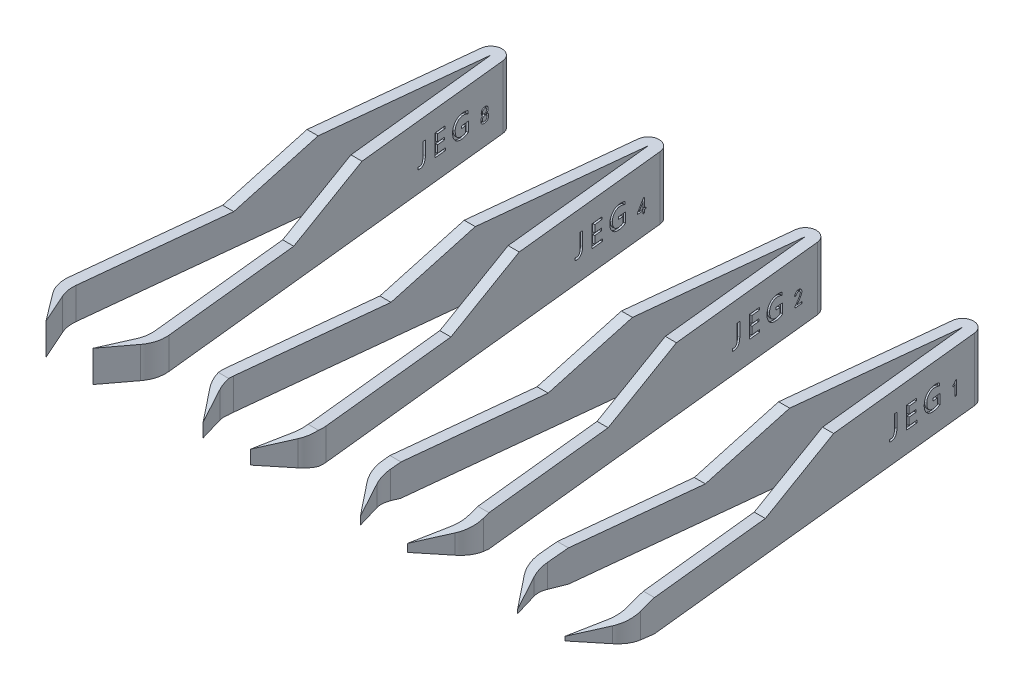
from build123d import *

# Parameters (mm, degrees)
EXTRUDE_510_DEPTH          = 16
CUT_EXTRUDE_729_DEPTH      = 110.141543163
CUT_EXTRUDE_729_DEPTH_BACK = 110.141543163
CUT_EXTRUDE_5_DEPTH        = 0.5
CUT_EXTRUDE_2_DEPTH        = 172.42262849
CUT_EXTRUDE_2_DEPTH_BACK   = 172.42262849
CUT_EXTRUDE_3_DEPTH        = 172.42262849
CUT_EXTRUDE_3_DEPTH_BACK   = 172.42262849
CUT_EXTRUDE_4_DEPTH        = 172.42262849
CUT_EXTRUDE_4_DEPTH_BACK   = 172.42262849
CUT_EXTRUDE_8_DEPTH        = 0.5
CUT_EXTRUDE_4_2_DEPTH      = 0.5
CUT_EXTRUDE_2_2_DEPTH      = 0.5
CUT_EXTRUDE_1_DEPTH        = 0.5


with BuildPart() as part:
    # Sketch 229 → Extrude 510 (new body)
    with BuildSketch(Plane(origin=(0, 0, 0), x_dir=(1, 0, 0), z_dir=(0, 1, 0))):
        with BuildLine():
            Line((-12.763846459, -94.652924797), (-2.784661307, 0.292679697))
            ThreePointArc((-2.784661307, 0.292679697), (0, 2.8), (2.784661307, 0.292679697))
            Line((2.784661307, 0.292679697), (12.763846459, -94.652924797))
            ThreePointArc((12.763846459, -94.652924797), (12.516714922, -97.627059512), (11.196755377, -100.303672688))
            Line((11.196755377, -100.303672688), (6, -107.2))
            Line((6, -107.2), (9.389355255, -99.587383458))
            ThreePointArc((9.389355255, -99.587383458), (9.982498318, -97.584966034), (10.037166756, -95.497262608))
            Line((10.037166756, -95.497262608), (0, 0))
            Line((0, 0), (-10.037166756, -95.497262608))
            ThreePointArc((-10.037166756, -95.497262608), (-9.982498318, -97.584966034), (-9.389355255, -99.587383458))
            Line((-9.389355255, -99.587383458), (-6, -107.2))
            Line((-6, -107.2), (-11.196755377, -100.303672688))
            ThreePointArc((-11.196755377, -100.303672688), (-12.516714922, -97.627059512), (-12.763846459, -94.652924797))
        make_face()
    extrude(amount=EXTRUDE_510_DEPTH)

    # Sketch 600 → Cut-Extrude 729 (cut, two sides: drawn at the far end of the back side and taken through both)
    with BuildSketch(Plane(origin=(0, 0, 0), x_dir=(0, 0, -1), z_dir=(1, 0, 0)).offset(-CUT_EXTRUDE_729_DEPTH_BACK)):
        Polygon((-107.2, 8), (-59.2, 8), (-39.783512161, 16), (-121.039092558, 27.463536836), align=None)
    extrude(amount=CUT_EXTRUDE_729_DEPTH + CUT_EXTRUDE_729_DEPTH_BACK, mode=Mode.SUBTRACT)

    # 草图7 → 切除-拉伸5 (cut)
    with BuildSketch(Plane(origin=(2.784661307, 0, -0.292679697), x_dir=(-0.10452846326765432, 0, -0.9945218953682733), z_dir=(0.9945218953682734, 0, -0.10452846326765433))):
        with BuildLine():
            Line((-24.324049204, 5.294945039), (-24.324049204, 5.933188179))
            add(Edge.make_bspline(
                [(-24.324049204, 5.933188179), (-24.248026892, 5.886509527), (-24.068354714, 5.816296052), (-23.876467428, 5.799250909), (-23.774887619, 5.799041838)],
                knots=[0, 0, 0, 0, 0.466417908, 1, 1, 1, 1], degree=3))
            add(Edge.make_bspline(
                [(-23.774887619, 5.799041838), (-23.707087537, 5.797595526), (-23.607633477, 5.809984144), (-23.482516426, 5.847913315), (-23.397595717, 5.887987253), (-23.320558748, 5.940706685), (-23.248165382, 6.002440193), (-23.18426918, 6.077863105), (-23.127881612, 6.164576759), (-23.077376317, 6.261804206), (-23.033293267, 6.37013167), (-22.997228147, 6.490309631), (-22.966643011, 6.621504573), (-22.944333564, 6.76413461), (-22.921218982, 6.976378368), (-22.91502871, 7.141789537), (-22.915512619, 7.255787264)],
                knots=[0, 0, 0, 0, 0.106608302, 0.156752619, 0.205505894, 0.253903597, 0.303461339, 0.354988549, 0.409035788, 0.466157673, 0.527388836, 0.593033596, 0.663670078, 0.73950742, 0.820357454, 1, 1, 1, 1], degree=3))
            Line((-22.915512619, 7.255787264), (-22.915512619, 10.762456472))
            Line((-22.915512619, 10.762456472), (-22.177707741, 10.762456472))
            Line((-22.177707741, 10.762456472), (-22.177707741, 7.273603575))
            add(Edge.make_bspline(
                [(-22.177707741, 7.273603575), (-22.177529837, 7.117196181), (-22.188423158, 6.888224893), (-22.234280711, 6.595184643), (-22.279731688, 6.395024368), (-22.341035177, 6.210001909), (-22.412666522, 6.037195445), (-22.500120395, 5.879819391), (-22.599579805, 5.736612591), (-22.710905762, 5.609621208), (-22.832019764, 5.498154685), (-22.96375544, 5.404968831), (-23.104196031, 5.326867103), (-23.255531912, 5.268918556), (-23.473278678, 5.209298081), (-23.645870636, 5.196061826), (-23.762311399, 5.195383301)],
                knots=[0, 0, 0, 0, 0.159071876, 0.23240712, 0.301324221, 0.367473493, 0.430334935, 0.491218005, 0.550134411, 0.607264001, 0.662568442, 0.717064202, 0.770945486, 0.825486358, 0.881397531, 1, 1, 1, 1], degree=3))
            add(Edge.make_bspline(
                [(-23.762311399, 5.195383301), (-23.866187891, 5.195007389), (-24.057854192, 5.209147201), (-24.244186316, 5.257929753), (-24.324049204, 5.294945039)],
                knots=[0, 0, 0, 0, 0.542364568, 1, 1, 1, 1], degree=3))
        make_face()
        Polygon((-16.476488229, 5.262456472), (-19.427707741, 5.262456472), (-19.427707741, 10.762456472), (-16.61063457, 10.762456472), (-16.61063457, 10.158797935), (-18.689902863, 10.158797935), (-18.689902863, 8.347822325), (-16.744780912, 8.347822325), (-16.744780912, 7.744163789), (-18.689902863, 7.744163789), (-18.689902863, 5.866115008), (-16.476488229, 5.866115008), align=None)
        with BuildLine():
            Line((-10.037463839, 10.544468667), (-10.037463839, 9.806663789))
            add(Edge.make_bspline(
                [(-10.037463839, 9.806663789), (-10.147211254, 9.877027121), (-10.321430305, 9.968784194), (-10.56661148, 10.065174667), (-10.759167126, 10.123513788), (-10.958964586, 10.170163337), (-11.240763154, 10.213339557), (-11.457487521, 10.226606322), (-11.604251186, 10.225871106)],
                knots=[0, 0, 0, 0, 0.237729296, 0.358233771, 0.480226218, 0.604546374, 0.732298464, 1, 1, 1, 1], degree=3))
            add(Edge.make_bspline(
                [(-11.604251186, 10.225871106), (-11.747552562, 10.226591824), (-11.959446821, 10.207948942), (-12.230732265, 10.142485844), (-12.421550583, 10.075688246), (-12.601815838, 9.987707823), (-12.772436188, 9.881211887), (-12.933793506, 9.756011372), (-13.082724575, 9.611337417), (-13.218628275, 9.452196583), (-13.336891382, 9.278892027), (-13.436486141, 9.093604168), (-13.519247405, 8.896269875), (-13.5813407, 8.685921442), (-13.642831645, 8.383337846), (-13.658940933, 8.14747092), (-13.659415058, 7.987304033)],
                knots=[0, 0, 0, 0, 0.125969474, 0.186009532, 0.244972384, 0.303350822, 0.361983194, 0.421513633, 0.482548577, 0.544210846, 0.605204821, 0.666631058, 0.728859788, 0.792989861, 0.859125726, 1, 1, 1, 1], degree=3))
            add(Edge.make_bspline(
                [(-13.659415058, 7.987304033), (-13.659646345, 7.823672381), (-13.644299192, 7.584524529), (-13.588935265, 7.278077417), (-13.531339828, 7.06856334), (-13.457122089, 6.872814798), (-13.365722358, 6.691352721), (-13.257178762, 6.524973884), (-13.13322344, 6.373409829), (-12.994847822, 6.238368954), (-12.844472799, 6.1200373), (-12.681510915, 6.020624413), (-12.506655003, 5.940452621), (-12.320999601, 5.875433704), (-12.051563475, 5.814733699), (-11.840569678, 5.800108239), (-11.697524814, 5.799041838)],
                knots=[0, 0, 0, 0, 0.147501684, 0.215382095, 0.280397875, 0.343092726, 0.403791293, 0.463185178, 0.521811921, 0.57993327, 0.637132791, 0.693948748, 0.751573178, 0.810231205, 0.870962438, 1, 1, 1, 1], degree=3))
            add(Edge.make_bspline(
                [(-11.697524814, 5.799041838), (-11.597802997, 5.799398193), (-11.45042899, 5.806620449), (-11.258811077, 5.832074147), (-11.123160728, 5.857837324), (-10.994072619, 5.892669602), (-10.831181461, 5.948217325), (-10.714996429, 6.001517153), (-10.641122375, 6.042182082)],
                knots=[0, 0, 0, 0, 0.273089439, 0.403369924, 0.529064051, 0.650883818, 0.769163094, 1, 1, 1, 1], degree=3))
            Line((-10.641122375, 6.042182082), (-10.641122375, 7.542944277))
            Line((-10.641122375, 7.542944277), (-11.848439448, 7.542944277))
            Line((-11.848439448, 7.542944277), (-11.848439448, 8.146602813))
            Line((-11.848439448, 8.146602813), (-9.903317497, 8.146602813))
            Line((-9.903317497, 8.146602813), (-9.903317497, 5.657559368))
            add(Edge.make_bspline(
                [(-9.903317497, 5.657559368), (-10.04009821, 5.58160624), (-10.25230794, 5.478799986), (-10.548293968, 5.373219142), (-10.777118441, 5.307566877), (-11.012518174, 5.257692955), (-11.338848948, 5.209856312), (-11.588133638, 5.195081235), (-11.756213839, 5.195383301)],
                knots=[0, 0, 0, 0, 0.243134103, 0.365368747, 0.487859787, 0.612727896, 0.738918392, 1, 1, 1, 1], degree=3))
            add(Edge.make_bspline(
                [(-11.756213839, 5.195383301), (-11.945451634, 5.194284793), (-12.223778322, 5.217702419), (-12.580766843, 5.29497795), (-12.828850519, 5.377119279), (-13.062064731, 5.483595536), (-13.282021212, 5.611725986), (-13.486020746, 5.764983986), (-13.674549596, 5.939669567), (-13.843942592, 6.134521085), (-13.992779007, 6.345979508), (-14.117803015, 6.574038694), (-14.220805339, 6.816956582), (-14.300772318, 7.075718256), (-14.377288113, 7.449706666), (-14.396718726, 7.741778241), (-14.397219936, 7.94014321)],
                knots=[0, 0, 0, 0, 0.132127422, 0.194359175, 0.254786118, 0.314307396, 0.373155964, 0.432263553, 0.492185725, 0.552381099, 0.612299793, 0.672483787, 0.73372138, 0.796322883, 0.861367418, 1, 1, 1, 1], degree=3))
            add(Edge.make_bspline(
                [(-14.397219936, 7.94014321), (-14.397201173, 8.142173136), (-14.374549986, 8.440822166), (-14.288924939, 8.82329589), (-14.202294778, 9.09172444), (-14.087899222, 9.345047269), (-13.950673506, 9.585814606), (-13.785805827, 9.810523467), (-13.598559966, 10.019543463), (-13.392284392, 10.209694555), (-13.169425916, 10.376120066), (-12.931852917, 10.516559441), (-12.68045441, 10.630802496), (-12.41512266, 10.720679769), (-12.035892653, 10.807173118), (-11.739548493, 10.829255283), (-11.539274052, 10.829529643)],
                knots=[0, 0, 0, 0, 0.13301234, 0.196153543, 0.257589465, 0.318307067, 0.378762934, 0.439648758, 0.501357676, 0.563189392, 0.623977903, 0.684069387, 0.744462707, 0.80538932, 0.86813288, 1, 1, 1, 1], degree=3))
            add(Edge.make_bspline(
                [(-11.539274052, 10.829529643), (-11.396896181, 10.83022337), (-11.187443583, 10.821050132), (-10.914624328, 10.791906588), (-10.722686167, 10.760125132), (-10.53878014, 10.720869911), (-10.308452254, 10.655677699), (-10.142609659, 10.593866412), (-10.037463839, 10.544468667)],
                knots=[0, 0, 0, 0, 0.27720918, 0.407935939, 0.534098837, 0.65593174, 0.773961276, 1, 1, 1, 1], degree=3))
        make_face()
    extrude(amount=-CUT_EXTRUDE_5_DEPTH, mode=Mode.SUBTRACT)


with BuildPart() as body_2:
    # Move Body 4: read off the stored shape, not the designer's step
    # Move Body 4: copy of part
    add(part.part.moved(Location((120, 0, 0))))

    # 4号 → Cut-Extrude 4 (cut, two sides: drawn at the far end of the back side and taken through both)
    with BuildSketch(Plane(origin=(0, 0, 0), x_dir=(0, 0, -1), z_dir=(1, 0, 0)).offset(-CUT_EXTRUDE_4_DEPTH_BACK)):
        Polygon((-107.2, 4.5), (-90.733794617, 8), (-90.829401652, 16), (-113.680324052, 26.530601745), align=None)
        Polygon((-107.2, 3.5), (-90.733794617, 0), (-114.904354173, -6.21298796), align=None)
    extrude(amount=CUT_EXTRUDE_4_DEPTH + CUT_EXTRUDE_4_DEPTH_BACK, mode=Mode.SUBTRACT)

    # 草图13 → 1标注 (cut)
    with BuildSketch(Plane(origin=(121.473517351, 0, -12.767381146), x_dir=(-0.10452846326765432, 0, -0.9945218953682733), z_dir=(0.9945218953682734, 0, -0.10452846326765433))):
        with BuildLine():
            add(Edge.make_bspline(
                [(-18.098239685, 7.893390772), (-18.144838358, 7.848683705), (-18.240869249, 7.756551051), (-18.402394809, 7.628533772), (-18.580427178, 7.501563682), (-18.708014224, 7.422424635), (-18.773678281, 7.381694866)],
                knots=[0, 0, 0, 0, 0.911926792, 1.879305458, 2.908561558, 4, 4, 4, 4], degree=3))
            Line((-18.773678281, 7.381694866), (-18.773678281, 7.770583755))
            add(Edge.make_bspline(
                [(-18.773678281, 7.770583755), (-18.731652034, 7.799698112), (-18.648187089, 7.857519794), (-18.529745779, 7.951566299), (-18.415236349, 8.047325785), (-18.308121529, 8.148709535), (-18.204995054, 8.252261358), (-18.10927276, 8.360883181), (-18.018113591, 8.472489792), (-17.962392889, 8.5503283), (-17.934496995, 8.589297205)],
                knots=[0, 0, 0, 0, 1.040526584, 2.066506081, 3.077559129, 4.07840537, 5.067830316, 6.05167646, 7.024595449, 8, 8, 8, 8], degree=3))
            Line((-17.934496995, 8.589297205), (-17.68888296, 8.589297205))
            Line((-17.68888296, 8.589297205), (-17.68888296, 5.068829369))
            Line((-17.68888296, 5.068829369), (-18.098239685, 5.068829369))
            Line((-18.098239685, 5.068829369), (-18.098239685, 7.893390772))
        make_face()
    extrude(amount=-CUT_EXTRUDE_1_DEPTH, mode=Mode.SUBTRACT)


with BuildPart() as body_3:
    # Move Body 4 2: copy of part
    add(part.part.moved(Location((80, 0, 0))))

    # 3号 → 切除-拉伸3 (cut, two sides: drawn at the far end of the back side and taken through both)
    with BuildSketch(Plane(origin=(0, 0, 0), x_dir=(0, 0, -1), z_dir=(1, 0, 0)).offset(-CUT_EXTRUDE_3_DEPTH_BACK)):
        Polygon((-111.304402429, -4.033826528), (-107.2, 3), (-93.086109672, 0), align=None)
        Polygon((-93.086109672, 8), (-109.658032158, 10.802090594), (-107.2, 5), align=None)
    extrude(amount=CUT_EXTRUDE_3_DEPTH + CUT_EXTRUDE_3_DEPTH_BACK, mode=Mode.SUBTRACT)

    # 草图11 → Cut-Extrude 2 2 (cut)
    with BuildSketch(Plane(origin=(81.910565336, 0, -8.60914733), x_dir=(-0.10452846326765432, 0, -0.9945218953682733), z_dir=(0.9945218953682734, 0, -0.10452846326765433))):
        with BuildLine():
            add(Edge.make_bspline(
                [(-14.816495196, 5.056353563), (-14.814019243, 5.081706472), (-14.809098162, 5.132096662), (-14.791818201, 5.206227207), (-14.767504026, 5.278604899), (-14.735515964, 5.349197288), (-14.69601891, 5.418032985), (-14.647436555, 5.48365459), (-14.593185785, 5.548954358), (-14.528306573, 5.610673946), (-14.458352371, 5.676343674), (-14.385894858, 5.751510851), (-14.307413315, 5.833575194), (-14.226087726, 5.926033992), (-14.138484325, 6.025562368), (-14.047972819, 6.135101033), (-13.952391425, 6.252554941), (-13.854422435, 6.375740295), (-13.758416197, 6.499464864), (-13.669943796, 6.61937242), (-13.589485294, 6.731332933), (-13.517690004, 6.835741673), (-13.456470994, 6.933801451), (-13.40330818, 7.023990565), (-13.357946196, 7.106145927), (-13.312679339, 7.204266773), (-13.269956451, 7.317425912), (-13.236457114, 7.445978002), (-13.221234512, 7.564951219), (-13.227218874, 7.674279637), (-13.250718929, 7.774049545), (-13.291777568, 7.864564177), (-13.34939717, 7.946145043), (-13.423063883, 8.015742296), (-13.507035012, 8.073041538), (-13.600480112, 8.111540576), (-13.700465486, 8.130997052), (-13.805068662, 8.129236756), (-13.910504794, 8.11049151), (-14.01554171, 8.077908925), (-14.116798346, 8.027458803), (-14.215997256, 7.964520388), (-14.307905968, 7.883436686), (-14.388688677, 7.783585437), (-14.457409153, 7.665475302), (-14.491693969, 7.578220958), (-14.509477652, 7.53296175)],
                knots=[0, 0, 0, 0, 0.683264685, 1.358023177, 2.0380809, 2.730345762, 3.435487858, 4.164189287, 4.919895072, 5.711413948, 6.565494804, 7.49616148, 8.513531843, 9.613812574, 10.80147361, 12.073102873, 13.428218159, 14.866997124, 16.298560904, 17.632315587, 18.867297526, 20.000038836, 21.033387935, 21.969994494, 22.810824564, 23.551397478, 24.869445784, 26.052467085, 27.111050094, 28.075902372, 28.975949733, 29.847314516, 30.728213316, 31.639844513, 32.554273251, 33.442456201, 34.333871785, 35.270085163, 36.233696473, 37.201335111, 38.211692251, 39.261697588, 40.347896805, 41.485826765, 42.695887429, 44, 44, 44, 44], degree=3))
            Line((-14.509477652, 7.53296175), (-14.898366541, 7.594365259))
            add(Edge.make_bspline(
                [(-14.898366541, 7.594365259), (-14.884636391, 7.632433437), (-14.857923483, 7.706497575), (-14.811924791, 7.81196132), (-14.764407059, 7.910134357), (-14.714066018, 8.000366204), (-14.659809545, 8.082012788), (-14.60295361, 8.155867874), (-14.543244876, 8.221921567), (-14.48045379, 8.280096606), (-14.414795984, 8.331380729), (-14.345820566, 8.375855972), (-14.27438639, 8.414706287), (-14.200212458, 8.44767798), (-14.1231386, 8.474249925), (-14.042822121, 8.493573391), (-13.960084508, 8.508564533), (-13.903587481, 8.513113885), (-13.874974728, 8.51541789)],
                knots=[0, 0, 0, 0, 1.318688324, 2.565594597, 3.747971738, 4.872722892, 5.930337296, 6.940181326, 7.908044283, 8.828858542, 9.726735078, 10.619953387, 11.500744836, 12.374616489, 13.262770363, 14.15366946, 15.064931369, 16, 16, 16, 16], degree=3))
            add(Edge.make_bspline(
                [(-13.874974728, 8.51541789), (-13.841643419, 8.518091184), (-13.776820473, 8.523290222), (-13.681809889, 8.524269122), (-13.592145962, 8.518067874), (-13.50624221, 8.506290581), (-13.422318711, 8.485471056), (-13.338213549, 8.454750296), (-13.253131339, 8.41322778), (-13.167210454, 8.362299928), (-13.082987847, 8.299956929), (-13.006737391, 8.221563989), (-12.939449515, 8.128638875), (-12.879329499, 8.023517993), (-12.830802917, 7.905330385), (-12.801619039, 7.773687231), (-12.790917333, 7.630885695), (-12.796797621, 7.504925191), (-12.811121631, 7.398338842), (-12.831191136, 7.313153077), (-12.860114681, 7.224474518), (-12.894168965, 7.130929668), (-12.939389347, 7.03473687), (-12.990288146, 6.933831269), (-13.051155066, 6.830042271), (-13.106391351, 6.74037373), (-13.156436029, 6.665714475), (-13.198352818, 6.604791993), (-13.244144567, 6.539760068), (-13.295542004, 6.471652692), (-13.349824199, 6.398908253), (-13.408214167, 6.322155141), (-13.471220145, 6.242058773), (-13.538113326, 6.157603987), (-13.609195753, 6.069016005), (-13.684788244, 5.976808205), (-13.764869919, 5.881187946), (-13.848194598, 5.780859486), (-13.935776903, 5.676663747), (-14.027683906, 5.568698907), (-14.124219139, 5.457451468), (-14.189595634, 5.381584279), (-14.222927945, 5.342903271)],
                knots=[0, 0, 0, 0, 0.924262298, 1.797511285, 2.623724224, 3.407158757, 4.191620419, 5.009283641, 5.877881841, 6.805175164, 7.767818098, 8.765683208, 9.814991193, 10.931884262, 12.107176208, 13.332417047, 14.642951659, 16.055476784, 16.810263112, 17.613474593, 18.470705512, 19.388078144, 20.363412498, 21.406914204, 22.511682051, 23.688322701, 24.318011351, 24.996206783, 25.732766533, 26.516574724, 27.354866926, 28.242087009, 29.182574856, 30.172115786, 31.220563025, 32.322544456, 33.468316952, 34.668650042, 35.928027342, 37.231299145, 38.588373428, 40, 40, 40, 40], degree=3))
            Line((-14.222927945, 5.342903271), (-12.749243734, 5.342903271))
            Line((-12.749243734, 5.342903271), (-12.749243734, 4.974482218))
            Line((-12.749243734, 4.974482218), (-14.816495196, 4.974482218))
            Line((-14.816495196, 4.974482218), (-14.816495196, 5.056353563))
        make_face()
    extrude(amount=-CUT_EXTRUDE_2_2_DEPTH, mode=Mode.SUBTRACT)


with BuildPart() as body_4:
    # Move Body 4 3: copy of part
    add(part.part.moved(Location((40, 0, 0))))

    # 2号 → Cut-Extrude 2 (cut, two sides: drawn at the far end of the back side and taken through both)
    with BuildSketch(Plane(origin=(0, 0, 0), x_dir=(0, 0, -1), z_dir=(1, 0, 0)).offset(-CUT_EXTRUDE_2_DEPTH_BACK)):
        Polygon((-107.2, 5.75), (-96.614582254, 8), (-110.199807714, 11.269828457), align=None)
        Polygon((-107.2, 2.25), (-96.614582254, 0), (-109.947860282, -4.450274704), align=None)
    extrude(amount=CUT_EXTRUDE_2_DEPTH + CUT_EXTRUDE_2_DEPTH_BACK, mode=Mode.SUBTRACT)

    # 草图12 → Cut-Extrude 4 2 (cut)
    with BuildSketch(Plane(origin=(42.347613322, 0, -4.450913514), x_dir=(-0.10452846326765432, 0, -0.9945218953682733), z_dir=(0.9945218953682734, 0, -0.10452846326765433))):
        Polygon((-9.053368335, 5.672598547), (-10.629391727, 5.672598547), (-10.629391727, 6.020551763), (-8.97149699, 8.415288605), (-8.664479447, 8.415288605), (-8.664479447, 6.020551763), (-8.173251376, 6.020551763), (-8.173251376, 5.672598547), (-8.664479447, 5.672598547), (-8.664479447, 4.894820769), (-9.053368335, 4.894820769), align=None)
        Polygon((-9.053368335, 6.020551763), (-9.053368335, 7.637510827), (-10.199567166, 6.020551763), align=None, mode=Mode.SUBTRACT)
    extrude(amount=-CUT_EXTRUDE_4_2_DEPTH, mode=Mode.SUBTRACT)


with BuildPart() as part_1:
    add(part.part)

    # 草图10 → 8标注 (cut)
    with BuildSketch(Plane(origin=(2.784661307, 0, -0.292679697), x_dir=(-0.10452846326765432, 0, -0.9945218953682733), z_dir=(0.9945218953682734, 0, -0.10452846326765433))):
        with BuildLine():
            add(Edge.make_bspline(
                [(-6.322846129, 6.201427452), (-6.321451799, 6.242228171), (-6.318648745, 6.324250792), (-6.293713114, 6.445796364), (-6.255703282, 6.566256902), (-6.211100235, 6.663993758), (-6.167593728, 6.740353686), (-6.12862668, 6.794877638), (-6.085030682, 6.846818659), (-6.036782993, 6.896236339), (-5.982209634, 6.941723025), (-5.923237642, 6.984796635), (-5.859330854, 7.025410977), (-5.813866623, 7.049031446), (-5.790682387, 7.061076575)],
                knots=[0, 0, 0, 0, 1.374126598, 2.76243824, 4.166032791, 5.626085304, 6.374165685, 7.125778304, 7.881627021, 8.658683375, 9.450540369, 10.273494042, 11.119577685, 12, 12, 12, 12], degree=3))
            add(Edge.make_bspline(
                [(-5.790682387, 7.061076575), (-5.828678509, 7.084716644), (-5.900820187, 7.129601074), (-5.994333472, 7.206922253), (-6.067440538, 7.288819164), (-6.120472178, 7.376099904), (-6.156478214, 7.468794136), (-6.183661792, 7.566141937), (-6.202670649, 7.669649459), (-6.212151706, 7.776974378), (-6.21263619, 7.883851361), (-6.202169669, 7.98551399), (-6.181907825, 8.079740452), (-6.151136852, 8.166775113), (-6.110056627, 8.24840188), (-6.059396176, 8.326031476), (-6.001938376, 8.402756233), (-5.934983949, 8.474183156), (-5.862737838, 8.539950193), (-5.785080472, 8.595125568), (-5.703175054, 8.638132371), (-5.61690405, 8.669060533), (-5.527365708, 8.691436587), (-5.434074281, 8.707280723), (-5.337336189, 8.717286542), (-5.238052859, 8.719718675), (-5.139620812, 8.717721615), (-5.044666353, 8.710281278), (-4.955032347, 8.6973957), (-4.868791445, 8.679376183), (-4.783920245, 8.652165093), (-4.697308554, 8.615026784), (-4.609931979, 8.563510876), (-4.519383093, 8.504905061), (-4.433454254, 8.432375232), (-4.359867584, 8.343376033), (-4.298812807, 8.240740375), (-4.26004325, 8.144904692), (-4.237366798, 8.062286008), (-4.224003748, 7.99701987), (-4.217620876, 7.928967262), (-4.215765438, 7.858491185), (-4.221104514, 7.785358835), (-4.229620962, 7.709520513), (-4.24538236, 7.631409994), (-4.265335025, 7.5516605), (-4.2915487, 7.472065288), (-4.329310045, 7.396641738), (-4.376115096, 7.325621457), (-4.431421673, 7.258624424), (-4.496983978, 7.196841445), (-4.571211554, 7.139236842), (-4.655363314, 7.086812198), (-4.7157408, 7.056310707), (-4.746822738, 7.040608739)],
                knots=[0, 0, 0, 0, 1.410033332, 2.677172402, 3.812064432, 4.856127883, 5.878591605, 6.938109193, 8.03995885, 9.192064022, 10.3315345, 11.405101817, 12.408541443, 13.363710648, 14.308049618, 15.282826904, 16.283668828, 17.326789228, 18.365059226, 19.359919842, 20.322241493, 21.272612498, 22.242786748, 23.229219042, 24.254411489, 25.306713209, 26.358803724, 27.358026599, 28.307996659, 29.212919167, 30.132734509, 31.114165642, 32.177631088, 33.326839266, 34.513504529, 35.70718515, 36.950754538, 38.266204093, 38.952498493, 39.651034787, 40.363832527, 41.105058096, 41.871509902, 42.674059092, 43.510125888, 44.381738271, 45.266222349, 46.146424753, 47.03266586, 47.943741995, 48.879333301, 49.867534116, 50.90222043, 52, 52, 52, 52], degree=3))
            add(Edge.make_bspline(
                [(-4.746822738, 7.040608739), (-4.718631939, 7.031924893), (-4.663883468, 7.015060268), (-4.586519674, 6.983704304), (-4.515322437, 6.949360081), (-4.450076538, 6.912197158), (-4.392190541, 6.869577607), (-4.339403326, 6.825316841), (-4.29349174, 6.776527862), (-4.242248044, 6.706127203), (-4.188973378, 6.610665717), (-4.143916586, 6.484390886), (-4.117956343, 6.346592364), (-4.109786674, 6.20221032), (-4.116447582, 6.060503379), (-4.131517158, 5.92910672), (-4.161082172, 5.813005133), (-4.20176736, 5.711722255), (-4.25044942, 5.623164158), (-4.299815302, 5.542094564), (-4.352425359, 5.468776907), (-4.408183735, 5.402365292), (-4.470365924, 5.342507608), (-4.542822945, 5.290721826), (-4.625375163, 5.245334846), (-4.718063357, 5.205707028), (-4.822718193, 5.174321271), (-4.939704314, 5.153288244), (-5.069419039, 5.139603883), (-5.207982973, 5.135765101), (-5.347790905, 5.139721684), (-5.481019149, 5.15341681), (-5.60441509, 5.174841682), (-5.71790351, 5.20593697), (-5.822126279, 5.245595035), (-5.915702057, 5.296975778), (-6.002566572, 5.353709171), (-6.078232979, 5.421958357), (-6.144401563, 5.496816514), (-6.199701548, 5.578396716), (-6.242375866, 5.666936534), (-6.274416283, 5.761734584), (-6.295274264, 5.863268613), (-6.31123843, 5.970315845), (-6.321431706, 6.083731527), (-6.322366064, 6.16148066), (-6.322846129, 6.201427452)],
                knots=[0, 0, 0, 0, 0.834664037, 1.620974963, 2.359958192, 3.071500661, 3.742523023, 4.391885647, 5.019370884, 5.633088925, 6.853041206, 8.099687998, 9.411290177, 10.808708308, 12.183221387, 13.42351142, 14.545940998, 15.563362997, 16.504155904, 17.403380615, 18.249005911, 19.055869055, 19.855247075, 20.685085447, 21.568786071, 22.517377533, 23.533390568, 24.654269325, 25.877028168, 27.222423441, 28.574967808, 29.833297063, 31.01045681, 32.11582339, 33.159850443, 34.158288642, 35.132345709, 36.089875077, 37.032569401, 37.955047952, 38.86995275, 39.806385064, 40.780048122, 41.799705361, 42.869508764, 44, 44, 44, 44], degree=3))
        make_face()
        with BuildLine():
            add(Edge.make_bspline(
                [(-5.90363452, 6.221895288), (-5.904104213, 6.182182602), (-5.905017303, 6.104980436), (-5.890209373, 5.992929201), (-5.863550323, 5.888493949), (-5.831436045, 5.807006054), (-5.796937912, 5.747726302), (-5.766571224, 5.707378754), (-5.731412739, 5.671106652), (-5.690759042, 5.640438398), (-5.646176517, 5.612348676), (-5.59639042, 5.589361838), (-5.541775865, 5.570253661), (-5.462912785, 5.55029171), (-5.359166885, 5.53607485), (-5.231823359, 5.530938341), (-5.1020947, 5.541836054), (-4.993535232, 5.55997668), (-4.908922875, 5.583945441), (-4.849474372, 5.606372367), (-4.795252982, 5.63457251), (-4.746223478, 5.668031334), (-4.70293162, 5.707248705), (-4.663748238, 5.750545798), (-4.630144659, 5.799519046), (-4.59381727, 5.871111915), (-4.558230491, 5.963764739), (-4.53214647, 6.077633789), (-4.521667929, 6.191213716), (-4.528211341, 6.285456751), (-4.541735317, 6.359129316), (-4.558408895, 6.41239063), (-4.581683426, 6.463094724), (-4.610538909, 6.511704181), (-4.645657839, 6.558435809), (-4.687695403, 6.602012952), (-4.734919304, 6.644075358), (-4.805174814, 6.695955931), (-4.900017693, 6.750348873), (-5.021602356, 6.796788288), (-5.149223118, 6.818314789), (-5.278673689, 6.818699416), (-5.404776235, 6.800273953), (-5.522543096, 6.763398464), (-5.628117632, 6.706654863), (-5.706318314, 6.646186765), (-5.760698321, 6.589877918), (-5.796367779, 6.544713854), (-5.828163873, 6.497867432), (-5.852793367, 6.447248625), (-5.873507456, 6.394577762), (-5.889678785, 6.33937612), (-5.899291228, 6.281316023), (-5.902173209, 6.241887536), (-5.90363452, 6.221895288)],
                knots=[0, 0, 0, 0, 1.45021583, 2.819245253, 4.116311686, 5.383839525, 6.004804309, 6.61809702, 7.225519428, 7.844420058, 8.474928218, 9.148418113, 9.843660174, 10.58739695, 12.118283095, 13.661739419, 15.236493707, 16.868915606, 17.675810439, 18.447690583, 19.187171155, 19.904516724, 20.610957382, 21.317398041, 22.03474361, 22.774224182, 24.247695365, 25.650274601, 27.031710525, 28.40179887, 29.088335786, 29.76605575, 30.435671148, 31.123139383, 31.828794671, 32.567062931, 33.332561727, 34.137975047, 35.755592712, 37.313353339, 38.869799076, 40.458468512, 42.027252455, 43.511108451, 44.944907386, 46.386035674, 47.104569492, 47.801282449, 48.487819365, 49.169367754, 49.853726664, 50.555320331, 51.267473945, 52, 52, 52, 52], degree=3))
        make_face(mode=Mode.SUBTRACT)
        with BuildLine():
            add(Edge.make_bspline(
                [(-5.831618059, 7.818386516), (-5.829802395, 7.784609591), (-5.826156263, 7.716780328), (-5.798201658, 7.616647934), (-5.752670928, 7.519544491), (-5.701018318, 7.442652105), (-5.650894296, 7.385545302), (-5.606900984, 7.347987971), (-5.558170137, 7.31579663), (-5.503635256, 7.290160201), (-5.444468567, 7.26965441), (-5.380133554, 7.255230484), (-5.310786765, 7.247355804), (-5.238050515, 7.24421191), (-5.165065087, 7.247389348), (-5.095220601, 7.255240283), (-5.030116689, 7.269627926), (-4.970036121, 7.29033283), (-4.914164034, 7.315736915), (-4.863855848, 7.348175382), (-4.817731242, 7.385474325), (-4.777165757, 7.428665338), (-4.741803938, 7.475880681), (-4.710441888, 7.525094558), (-4.684339922, 7.577100315), (-4.664300307, 7.631368204), (-4.648584718, 7.687598177), (-4.639183125, 7.746088693), (-4.633645257, 7.806888487), (-4.633742608, 7.869044057), (-4.638990704, 7.930130033), (-4.648604348, 7.988337407), (-4.663610706, 8.042337911), (-4.684340665, 8.092161945), (-4.709969914, 8.137998759), (-4.74164628, 8.17903086), (-4.777217846, 8.216795532), (-4.818798756, 8.249147173), (-4.863937796, 8.278236507), (-4.913962534, 8.301416015), (-4.967065074, 8.321395239), (-5.024229752, 8.33642166), (-5.085095327, 8.346977107), (-5.149980484, 8.352936233), (-5.218624388, 8.354359444), (-5.289467568, 8.351068455), (-5.359424946, 8.344836783), (-5.425641239, 8.333600329), (-5.48642232, 8.317587033), (-5.541899087, 8.298198151), (-5.591996868, 8.274371581), (-5.636951457, 8.24667268), (-5.675944299, 8.213638511), (-5.719888856, 8.165147287), (-5.765023167, 8.098499245), (-5.802827578, 8.010653793), (-5.827832332, 7.916791021), (-5.830338278, 7.851652578), (-5.831618059, 7.818386516)],
                knots=[0, 0, 0, 0, 1.534693845, 3.081901317, 4.691243309, 6.396534232, 7.275531407, 8.139372323, 9.019120457, 9.923811509, 10.872401943, 11.862147786, 12.91556615, 14.042756034, 15.169945918, 16.234774491, 17.235732746, 18.195190674, 19.120665344, 20.019718268, 20.909987491, 21.812339702, 22.706457796, 23.589652117, 24.463374508, 25.347092071, 26.216951264, 27.114386788, 28.037289102, 28.991155695, 29.936957382, 30.823062971, 31.670776101, 32.479662527, 33.27221946, 34.051415611, 34.83171274, 35.625019215, 36.441220146, 37.268830285, 38.126995544, 39.019043232, 39.952404705, 40.933573035, 41.979631126, 43.072373492, 44.157596343, 45.172184403, 46.122722093, 47.013287973, 47.840898113, 48.641248973, 49.407885578, 50.156214404, 51.612891957, 53.043495678, 54.490119686, 56, 56, 56, 56], degree=3))
        make_face(mode=Mode.SUBTRACT)
    extrude(amount=-CUT_EXTRUDE_8_DEPTH, mode=Mode.SUBTRACT)


solid = Compound([body_2.part, body_3.part, body_4.part, part_1.part])
